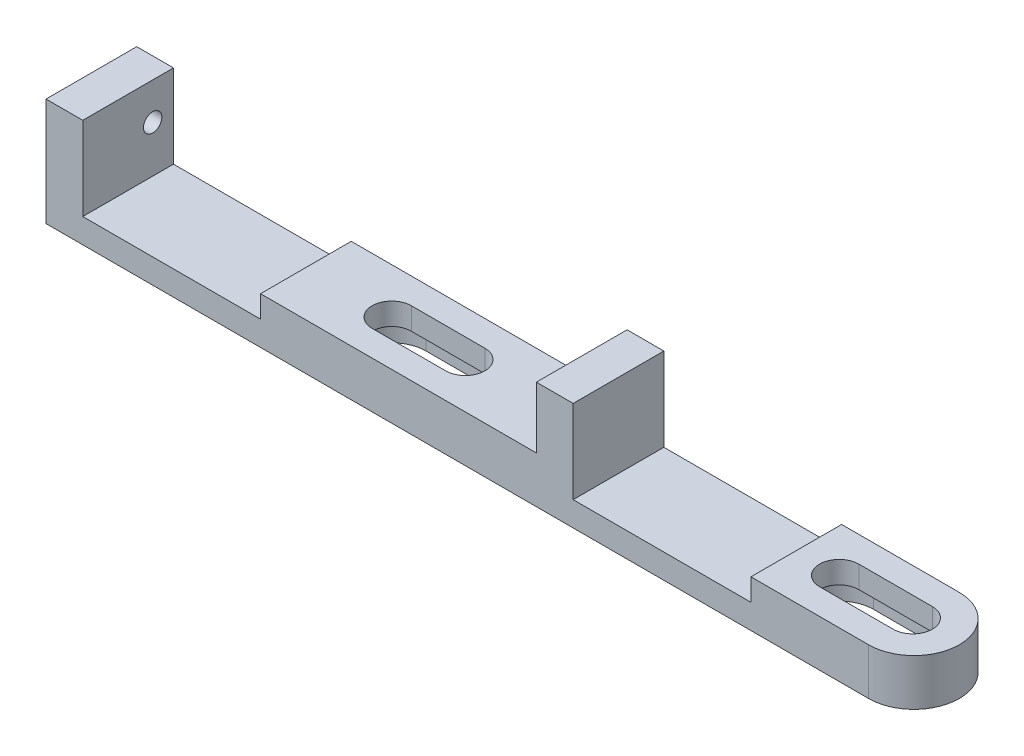
from build123d import *

# Parameters (mm, degrees)
BOSS_EXTRUDE1_DEPTH = 7.4
CUT_EXTRUDE1_DEPTH  = 10
CUT_EXTRUDE2_START  = -2
CUT_EXTRUDE2_DEPTH  = 2
CUT_EXTRUDE3_REACH  = 73.728
SKETCH5_R           = 0.75
CUT_EXTRUDE4_DEPTH  = 10


with BuildPart() as part:
    # Sketch1 → Boss-Extrude1 (new body)
    with BuildSketch(Plane.XY):
        Polygon((0, 0), (0, 8.8), (3, 8.8), (3, 2), (17.5, 2), (17.5, 3.8), (40, 3.8), (40, 8.8), (43, 8.8), (43, 2), (57.5, 2), (57.5, 3.8), (70.8, 3.8), (70.8, 0), align=None)
    extrude(amount=BOSS_EXTRUDE1_DEPTH)

    # Sketch3 → Cut-Extrude1 (cut)
    with BuildSketch(Plane(origin=(0, 3.8, 0), x_dir=(1, 0, 0), z_dir=(0, 1, 0))):
        with BuildLine():
            Line((30.5, -5.3), (24.5, -5.3))
            ThreePointArc((24.5, -5.3), (22.9, -3.7), (24.5, -2.1))
            Line((24.5, -2.1), (30.5, -2.1))
            ThreePointArc((30.5, -2.1), (32.1, -3.7), (30.5, -5.3))
        make_face()
        with BuildLine():
            Line((67, -5.3), (61, -5.3))
            ThreePointArc((61, -5.3), (59.4, -3.7), (61, -2.1))
            Line((61, -2.1), (67, -2.1))
            ThreePointArc((67, -2.1), (68.6, -3.7), (67, -5.3))
        make_face()
    extrude(amount=-CUT_EXTRUDE1_DEPTH, mode=Mode.SUBTRACT)

    # Sketch4 → Cut-Extrude2 (cut)
    # profile 1 of 2: a face of its own
    with BuildSketch(Plane.XZ.offset(CUT_EXTRUDE2_START)):
        with BuildLine():
            Line((24.5, 6.5), (30.5, 6.5))
            ThreePointArc((30.5, 6.5), (33.3, 3.7), (30.5, 0.9))
            Line((30.5, 0.9), (24.5, 0.9))
            ThreePointArc((24.5, 0.9), (21.7, 3.7), (24.5, 6.5))
        make_face()
        with BuildLine():
            Line((24.5, 5.3), (30.5, 5.3))
            ThreePointArc((30.5, 5.3), (32.1, 3.7), (30.5, 2.1))
            Line((30.5, 2.1), (24.5, 2.1))
            ThreePointArc((24.5, 2.1), (22.9, 3.7), (24.5, 5.3))
        make_face(mode=Mode.SUBTRACT)
    # profile 2 of 2: a face of its own
    with BuildSketch(Plane.XZ.offset(CUT_EXTRUDE2_START)):
        with BuildLine():
            Line((61, 6.5), (67, 6.5))
            ThreePointArc((67, 6.5), (69.8, 3.7), (67, 0.9))
            Line((67, 0.9), (61, 0.9))
            ThreePointArc((61, 0.9), (58.2, 3.7), (61, 6.5))
        make_face()
        with BuildLine():
            Line((61, 5.3), (67, 5.3))
            ThreePointArc((67, 5.3), (68.6, 3.7), (67, 2.1))
            Line((67, 2.1), (61, 2.1))
            ThreePointArc((61, 2.1), (59.4, 3.7), (61, 5.3))
        make_face(mode=Mode.SUBTRACT)
    extrude(amount=CUT_EXTRUDE2_DEPTH, mode=Mode.SUBTRACT)

    # Sketch5 → Cut-Extrude3 (cut, up to next)
    with BuildSketch(Plane.ZY, mode=Mode.PRIVATE) as cut_extrude3_sk1:
        with Locations((1.7, 5.8)):
            Circle(SKETCH5_R)
    cut_extrude3_tool1 = extrude(cut_extrude3_sk1.sketch, amount=-CUT_EXTRUDE3_REACH, mode=Mode.PRIVATE) & part.part
    add(cut_extrude3_tool1.solids().sort_by_distance((0, 5.8, 1.7))[0], mode=Mode.SUBTRACT)

    # Sketch6 → Cut-Extrude4 (cut)
    with BuildSketch(Plane.XZ):
        with BuildLine():
            Line((67.1, 0), (70.8, 0))
            Line((70.8, 0), (70.8, 3.7))
            ThreePointArc((70.8, 3.7), (69.71629509, 1.08370491), (67.1, 0))
        make_face()
        with BuildLine():
            ThreePointArc((67.1, 7.4), (69.71629509, 6.31629509), (70.8, 3.7))
            Line((70.8, 3.7), (70.8, 7.4))
            Line((70.8, 7.4), (67.1, 7.4))
        make_face()
    extrude(amount=-CUT_EXTRUDE4_DEPTH, mode=Mode.SUBTRACT)


solid = part.part
